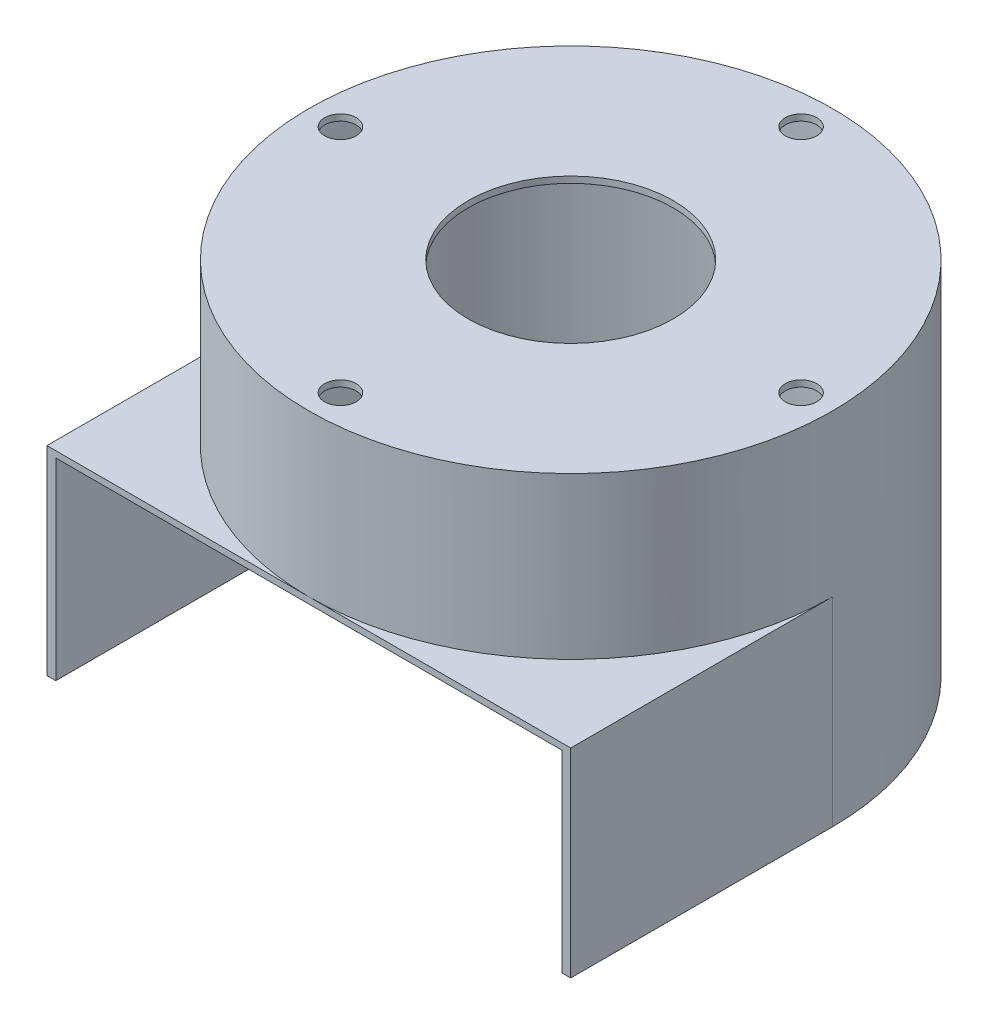
from build123d import *

# Parameters (mm, degrees)
BOSS_EXTRUDE1_DEPTH      = 61.14
SKETCH2_R                = 80
BOSS_EXTRUDE2_DEPTH      = 2
SKETCH3_R                = 83
SKETCH3_R_2              = 80
BOSS_EXTRUDE3_DEPTH      = 49.01
SKETCH6_R                = 83
SKETCH6_R_2              = 32.5
BOSS_EXTRUDE4_DEPTH      = 2
MOVE_START               = -80.2
MOVE_FACE1_OUTLINE_W     = 61.14
MOVE_FACE1_OUTLINE_H     = 0.2
MOVE_FACE1_DEPTH         = 160.4
MOVE_FACE1_2_OUTLINE_R   = 80.2
MOVE_FACE1_2_OUTLINE_R_2 = 80
MOVE_FACE1_2_DEPTH       = 112.15
MOVE_FACE1_3_DEPTH       = 61.14
SKETCH7_R                = 5
CUT_EXTRUDE1_DEPTH       = 164.732166968
CUT_EXTRUDE2_DEPTH       = 216.762514121


with BuildPart() as part:
    # Sketch1 → Boss-Extrude1 (new body)
    with BuildSketch(Plane(origin=(0, 0, 0), x_dir=(1, 0, 0), z_dir=(0, 1, 0))):
        with BuildLine():
            Line((0, -83), (83, -83))
            Line((83, -83), (83, 0))
            ThreePointArc((83, 0), (0, 83), (-83, 0))
            Line((-83, 0), (-83, -83))
            Line((-83, -83), (0, -83))
        make_face()
        with BuildLine():
            Line((-80, 0), (-80, -80))
            Line((-80, -80), (0, -80))
            Line((0, -80), (80, -80))
            Line((80, -80), (80, 0))
            ThreePointArc((80, 0), (0, 80), (-80, 0))
        make_face(mode=Mode.SUBTRACT)
    extrude(amount=BOSS_EXTRUDE1_DEPTH)

    # Sketch2 → Boss-Extrude2 (add)
    with BuildSketch(Plane(origin=(0, 61.14, 0), x_dir=(1, 0, 0), z_dir=(0, 1, 0))):
        with BuildLine():
            Line((-83, -83), (83, -83))
            Line((83, -83), (83, 0))
            ThreePointArc((83, 0), (0, 83), (-83, 0))
            Line((-83, 0), (-83, -83))
        make_face()
        with Locations(Location((0, 0, 0), (0, 0, 270))):
            Circle(SKETCH2_R, mode=Mode.SUBTRACT)
    extrude(amount=BOSS_EXTRUDE2_DEPTH)

    # Sketch3 → Boss-Extrude3 (add)
    with BuildSketch(Plane(origin=(0, 63.14, 0), x_dir=(1, 0, 0), z_dir=(0, 1, 0))):
        with Locations(Location((0, 0, 0), (0, 0, 270))):
            Circle(SKETCH3_R)
        with Locations(Location((0, 0, 0), (0, 0, 270))):
            Circle(SKETCH3_R_2, mode=Mode.SUBTRACT)
    extrude(amount=BOSS_EXTRUDE3_DEPTH)

    # Sketch6 → Boss-Extrude4 (add)
    with BuildSketch(Plane(origin=(0, 112.15, 0), x_dir=(1, 0, 0), z_dir=(0, 1, 0))):
        with Locations(Location((0, 0, 0), (0, 0, 270))):
            Circle(SKETCH6_R)
        with Locations(Location((0, 0, 0), (0, 0, 270))):
            Circle(SKETCH6_R_2, mode=Mode.SUBTRACT)
    extrude(amount=BOSS_EXTRUDE4_DEPTH)

    # Move Face1: read off the stored shape, not the designer's step
    # Move Face1 outline → Move Face1 (cut)
    with BuildSketch(Plane.YZ.offset(MOVE_START)):
        with Locations((30.57, 80.1)):
            Rectangle(MOVE_FACE1_OUTLINE_W, MOVE_FACE1_OUTLINE_H)
    extrude(amount=MOVE_FACE1_DEPTH, mode=Mode.SUBTRACT)

    # Move Face1 2 outline → Move Face1 2 (cut)
    with BuildSketch(Plane(origin=(0, 0, 0), x_dir=(1, 0, 0), z_dir=(0, 1, 0))):
        Circle(MOVE_FACE1_2_OUTLINE_R)
        Circle(MOVE_FACE1_2_OUTLINE_R_2, mode=Mode.SUBTRACT)
    extrude(amount=MOVE_FACE1_2_DEPTH, mode=Mode.SUBTRACT)

    # Move Face1 3 outline → Move Face1 3 (cut)
    with BuildSketch(Plane(origin=(0, 0, 0), x_dir=(1, 0, 0), z_dir=(0, 1, 0))):
        with BuildLine():
            Line((80.2, -80), (80.2, 0))
            ThreePointArc((80.2, 0), (80.149984404, -2.831960452), (80, -5.660388679))
            Line((80, -5.660388679), (80, -80))
            Line((80, -80), (80.2, -80))
        make_face()
        with BuildLine():
            ThreePointArc((-80, -5.660388679), (-80.149984404, -2.831960452), (-80.2, 0))
            Line((-80.2, 0), (-80.2, -80))
            Line((-80.2, -80), (-80, -80))
            Line((-80, -80), (-80, -5.660388679))
        make_face()
    extrude(amount=MOVE_FACE1_3_DEPTH, mode=Mode.SUBTRACT)

    # Sketch7 → Cut-Extrude1 (cut, through all)
    with BuildSketch(Plane(origin=(0, 114.15, 0), x_dir=(1, 0, 0), z_dir=(0, 1, 0))):
        with Locations(Location((0, 73, 0), (0, 0, 270))):
            Circle(SKETCH7_R)
        with Locations(Location((73, 0, 0), (0, 0, 270))):
            Circle(SKETCH7_R)
        with Locations(Location((0, -73, 0), (0, 0, 270))):
            Circle(SKETCH7_R)
        with Locations(Location((-73, 0, 0), (0, 0, 270))):
            Circle(SKETCH7_R)
    extrude(amount=-CUT_EXTRUDE1_DEPTH, mode=Mode.SUBTRACT)

    # Sketch8 → Cut-Extrude2 (cut, through all)
    with BuildSketch(Plane(origin=(0, 0, 80.2), x_dir=(-1, 0, 0), z_dir=(0, 0, -1))):
        Polygon((-80.2, 0), (80.2, 0), (80.2, 61.14), (0, 61.14), (-80.2, 61.14), align=None)
    extrude(amount=-CUT_EXTRUDE2_DEPTH, mode=Mode.SUBTRACT)


solid = part.part
